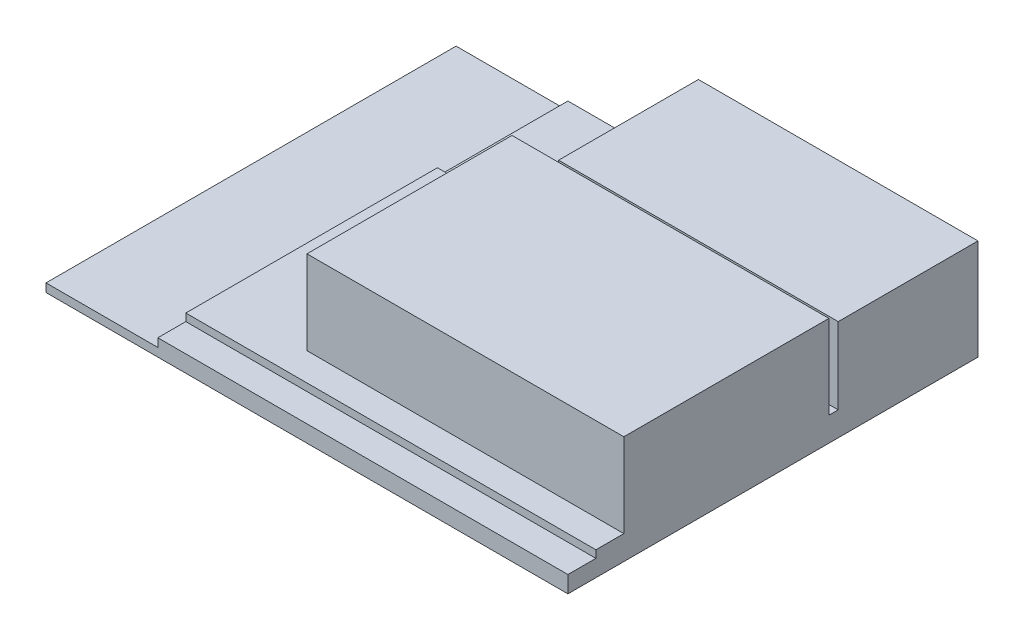
from build123d import *

# Parameters (mm, degrees)
SKETCH1_W           = 220
SKETCH1_H           = 220
BOSS_EXTRUDE1_DEPTH = 4.5
SKETCH2_W           = 220
SKETCH2_H           = 135
BOSS_EXTRUDE2_DEPTH = 4
SKETCH3_W           = 150
SKETCH3_H           = 75
BOSS_EXTRUDE3_DEPTH = 45
SKETCH4_W           = 170
SKETCH4_H           = 110
BOSS_EXTRUDE4_DEPTH = 45
SKETCH5_W           = 280
SKETCH5_H           = 220
BOSS_EXTRUDE5_DEPTH = 4.5


with BuildPart() as part:
    # Sketch1 → Boss-Extrude1 (new body)
    with BuildSketch(Plane(origin=(0, 0, 0), x_dir=(1, 0, 0), z_dir=(0, 1, 0))):
        with Locations((-18.301886792, -38.490566038)):
            Rectangle(SKETCH1_W, SKETCH1_H)
    extrude(amount=BOSS_EXTRUDE1_DEPTH)

    # Sketch2 → Boss-Extrude2 (add)
    with BuildSketch(Plane(origin=(0, 4.5, 0), x_dir=(1, 0, 0), z_dir=(0, 1, 0))):
        with Locations((-18.301886792, -65.990566038)):
            Rectangle(SKETCH2_W, SKETCH2_H)
    extrude(amount=BOSS_EXTRUDE2_DEPTH)

    # Sketch3 → Boss-Extrude3 (add)
    with BuildSketch(Plane(origin=(0, 4.5, 0), x_dir=(1, 0, 0), z_dir=(0, 1, 0))):
        with Locations((16.698113208, 34.009433962)):
            Rectangle(SKETCH3_W, SKETCH3_H)
    extrude(amount=BOSS_EXTRUDE3_DEPTH)

    # Sketch4 → Boss-Extrude4 (add)
    with BuildSketch(Plane(origin=(0, 8.5, 0), x_dir=(1, 0, 0), z_dir=(0, 1, 0))):
        with Locations((6.698113208, -63.490566038)):
            Rectangle(SKETCH4_W, SKETCH4_H)
    extrude(amount=BOSS_EXTRUDE4_DEPTH)

    # Sketch5 → Boss-Extrude5 (add)
    with BuildSketch(Plane.XZ):
        with Locations((-48.301886792, 38.490566038)):
            Rectangle(SKETCH5_W, SKETCH5_H)
    extrude(amount=BOSS_EXTRUDE5_DEPTH)


solid = part.part
